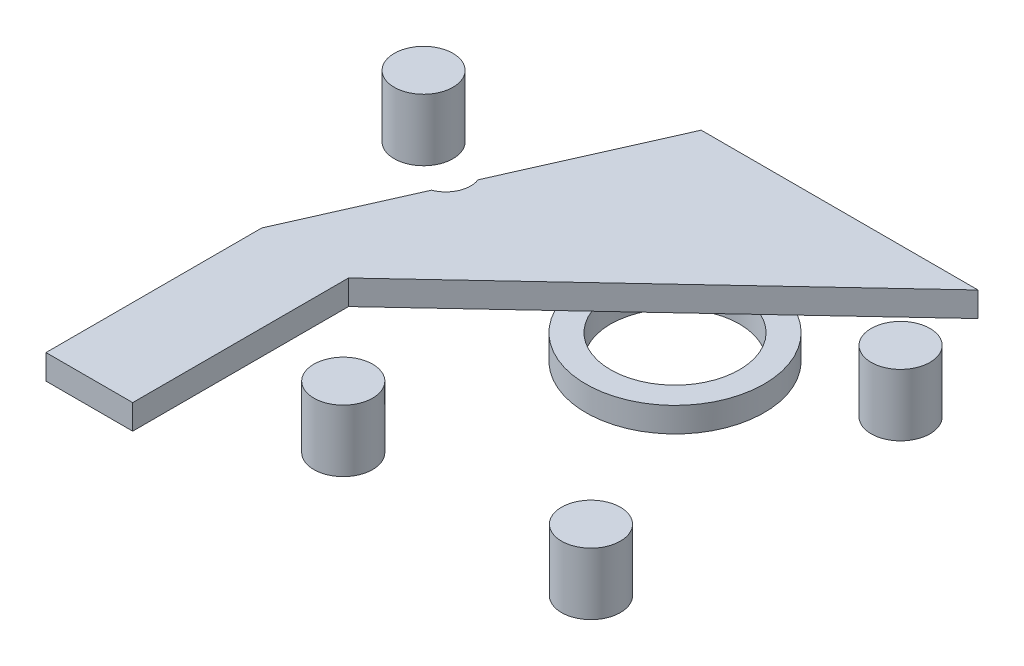
from build123d import *

# Parameters (mm, degrees)
BOSS_EXTRUDE1_DEPTH   = 2
SKETCH3_R             = 2.375
BOSS_EXTRUDE3_DEPTH   = 5
SKETCH3_R_2           = 2.372845421
BOSS_EXTRUDE3_2_DEPTH = 5
BOSS_EXTRUDE3_3_DEPTH = 5
BOSS_EXTRUDE3_4_DEPTH = 5
SKETCH4_R             = 7.2
SKETCH4_R_2           = 5.2
BOSS_EXTRUDE4_DEPTH   = 2
SKETCH6_R             = 2
CUT_EXTRUDE2_DEPTH    = 1


with BuildPart() as part:
    # Sketch1 → Boss-Extrude1 (new body)
    with BuildSketch(Plane(origin=(0, 0, 0), x_dir=(1, 0, 0), z_dir=(0, 1, 0))):
        Polygon((-3.5, 8.714285714), (-3.5, -8.714285714), (3.5, -8.714285714), (3.5, 8.714285714), (29.75, 33.285714286), (7.4, 33.285714286), align=None)
    extrude(amount=BOSS_EXTRUDE1_DEPTH)

    # Sketch4 → Boss-Extrude4 (add)
    with BuildSketch(Plane.XZ):
        with Locations((18.5, -20.073465622)):
            Circle(SKETCH4_R)
        with Locations((18.5, -20.073465622)):
            Circle(SKETCH4_R_2, mode=Mode.SUBTRACT)
    extrude(amount=BOSS_EXTRUDE4_DEPTH)

    # Sketch6 → Cut-Extrude2 (cut)
    with BuildSketch(Plane(origin=(0, 2, 0), x_dir=(1, 0, 0), z_dir=(0, 1, 0))):
        with Locations((0, 20.073465622)):
            Circle(SKETCH6_R)
    extrude(amount=-CUT_EXTRUDE2_DEPTH, mode=Mode.SUBTRACT)


with BuildPart() as body_2:
    # Sketch3 → Boss-Extrude3 (new body)
    with BuildSketch(Plane.XZ):
        with Locations((8.5, -3.285714286)):
            Circle(SKETCH3_R)
    extrude(amount=BOSS_EXTRUDE3_DEPTH)


with BuildPart() as body_3:
    # Sketch3 → Boss-Extrude3 2 (new body)
    with BuildSketch(Plane.XZ):
        with Locations((-9.991570168, -28.264481029)):
            Circle(SKETCH3_R_2)
    extrude(amount=BOSS_EXTRUDE3_2_DEPTH)


with BuildPart() as body_4:
    # Sketch3 → Boss-Extrude3 3 (new body)
    with BuildSketch(Plane.XZ):
        with Locations((28.5, -28.285714286)):
            Circle(SKETCH3_R)
    extrude(amount=BOSS_EXTRUDE3_3_DEPTH)


with BuildPart() as body_5:
    # Sketch3 → Boss-Extrude3 4 (new body)
    with BuildSketch(Plane.XZ):
        with Locations((28.5, -3.285714286)):
            Circle(SKETCH3_R)
    extrude(amount=BOSS_EXTRUDE3_4_DEPTH)


solid = Compound([part.part, body_2.part, body_3.part, body_4.part, body_5.part])
